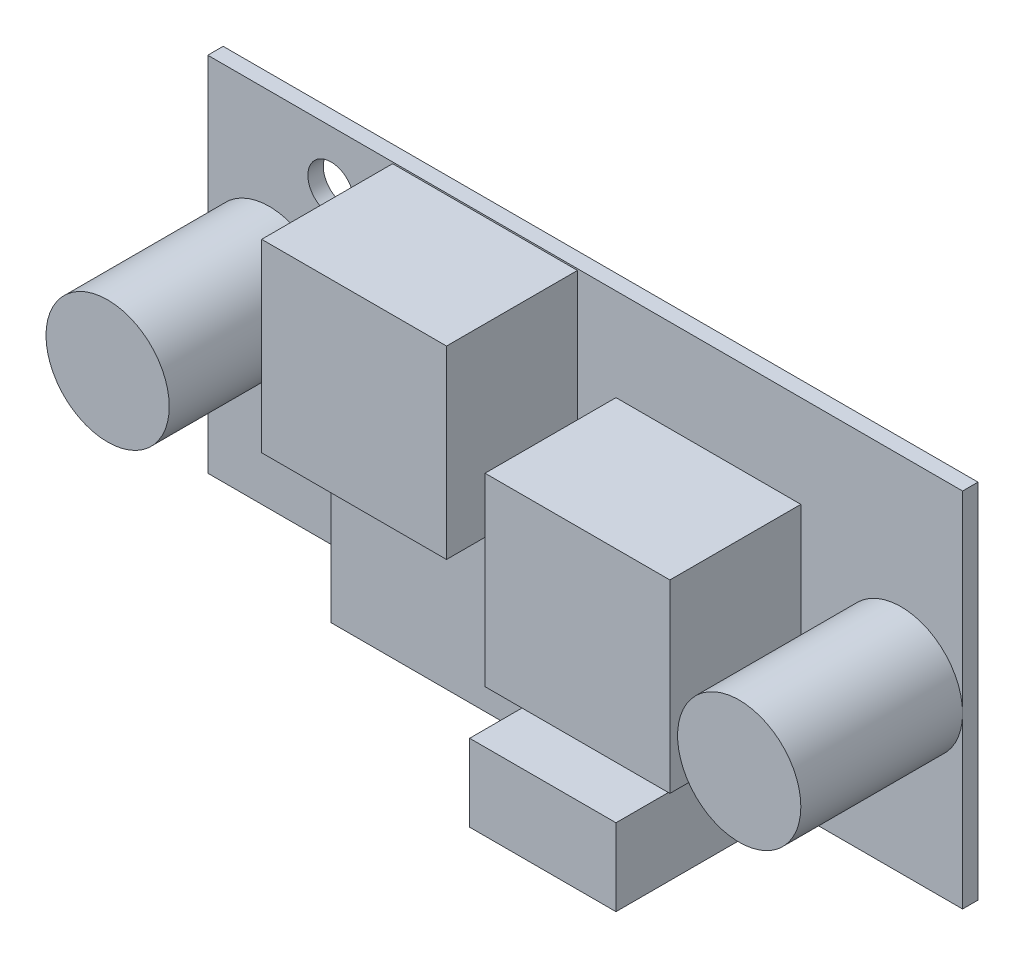
from build123d import *

# Parameters (mm, degrees)
SKETCH_1_W         = 49
SKETCH_1_H         = 23.5
SKETCH_1_R         = 1.5
EXTRUDE_514_DEPTH  = 1
SKETCH_2_R         = 4
EXTRUDE_1246_DEPTH = 10.5
SKETCH_2_3_W       = 9.5
SKETCH_2_3_H       = 5
EXTRUDE_1291_DEPTH = 11.5
SKETCH_2_5_W       = 12
SKETCH_2_5_H       = 12
EXTRUDE_1431_DEPTH = 8.5
SKETCH_2_6_W       = 13
SKETCH_2_6_H       = 10
EXTRUDE_1655_DEPTH = 4.5


with BuildPart() as part:
    # Эскиз1 → Extrude 514 (new body)
    with BuildSketch(Plane.XY):
        Rectangle(SKETCH_1_W, SKETCH_1_H)
        with Locations((-16.5, 8.25)):
            Circle(SKETCH_1_R, mode=Mode.SUBTRACT)
        with Locations((16.5, -8.25)):
            Circle(SKETCH_1_R, mode=Mode.SUBTRACT)
    extrude(amount=EXTRUDE_514_DEPTH)

    # Эскиз2 → Extrude 1246 (add)
    with BuildSketch(Plane.XY.offset(1)):
        with Locations((-20.5, 1.25)):
            Circle(SKETCH_2_R)
        with Locations((20.5, -0.75)):
            Circle(SKETCH_2_R)
    extrude(amount=EXTRUDE_1246_DEPTH)

    # Эскиз2<3> → Extrude 1291 (add)
    with BuildSketch(Plane.XY.offset(1)):
        with Locations((8.75, -9.15)):
            Rectangle(SKETCH_2_3_W, SKETCH_2_3_H)
    extrude(amount=EXTRUDE_1291_DEPTH)

    # Эскиз2<5> → Extrude 1431 (add)
    with BuildSketch(Plane.XY.offset(1)):
        with Locations((-6.5, 5.65)):
            Rectangle(SKETCH_2_5_W, SKETCH_2_5_H)
        with Locations((8, -0.25)):
            Rectangle(SKETCH_2_5_W, SKETCH_2_5_H)
    extrude(amount=EXTRUDE_1431_DEPTH)

    # Эскиз2<6> → Extrude 1655 (add)
    with BuildSketch(Plane.XY.offset(1)):
        with Locations((-5.5, -6.65)):
            Rectangle(SKETCH_2_6_W, SKETCH_2_6_H)
    extrude(amount=EXTRUDE_1655_DEPTH)


solid = part.part
